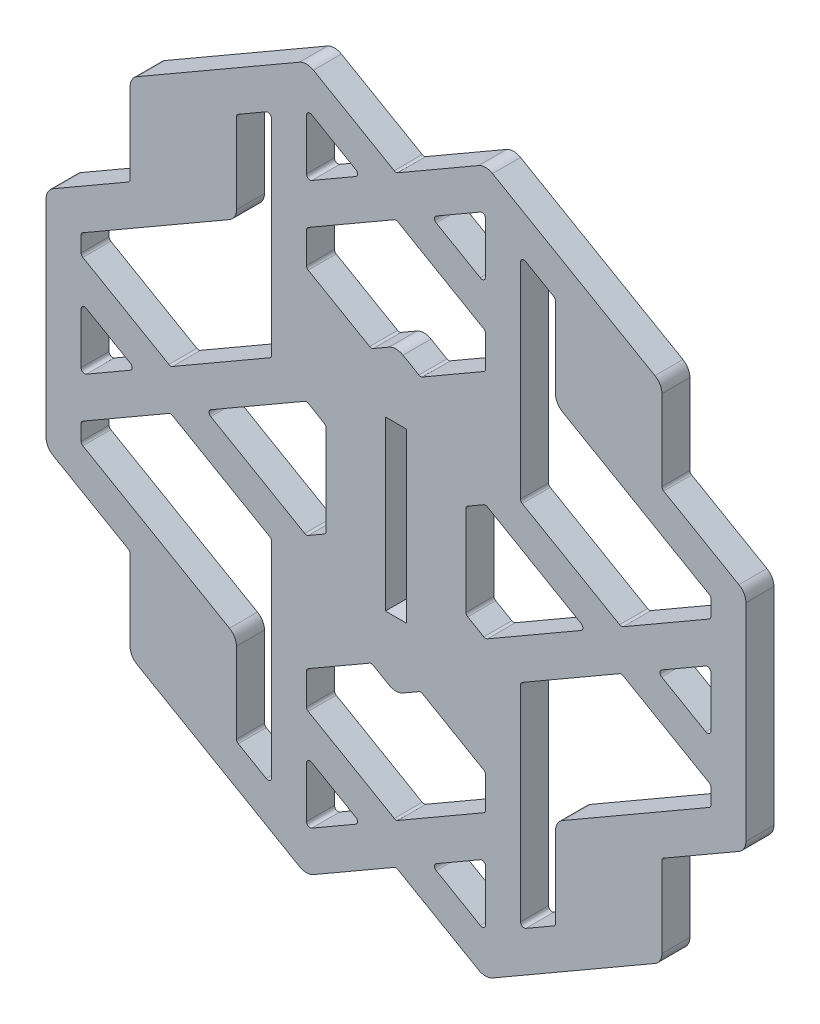
from build123d import *

# Parameters (mm, degrees)
EXTRUDE_1_DEPTH     = 4
SKETCH_2_W          = 3.02
SKETCH_2_H          = 24.02
CUT_EXTRUDE_1_DEPTH = 4
FILLET_1_R          = 2
FILLET_2_R          = 0.5


with BuildPart() as part:
    # 草图1 → 凸台-拉伸1 (new body)
    with BuildSketch(Plane.XY):
        Polygon((-38, -22.856406461), (-38, -35.79571669), (-12.794228634, -50.348275573), (0, -42.961524227), (12.794228634, -50.348275573), (38, -35.79571669), (38, -22.856406461), (50, -15.92820323), (50, -13.160254038), (50, 13.160254038), (50, 15.92820323), (38, 22.856406461), (38, 35.79571669), (12.794228634, 50.348275573), (0, 42.961524227), (-12.794228634, 50.348275573), (-38, 35.79571669), (-38, 22.856406461), (-50, 15.92820323), (-50, 13.160254038), (-50, -13.160254038), (-50, -15.92820323), align=None)
        Polygon((-10, -6.707259422), (-10, 6.707259422), (-12.794228634, 8.320508076), (-27.205771366, 0), (-12.794228634, -8.320508076), align=None, mode=Mode.SUBTRACT)
        Polygon((-12.794228634, -44.574772881), (-12.794228634, -35.574772881), (-5, -40.074772881), align=None, mode=Mode.SUBTRACT)
        Polygon((10, -6.707259422), (10, 6.707259422), (12.794228634, 8.320508076), (27.205771366, 0), (12.794228634, -8.320508076), align=None, mode=Mode.SUBTRACT)
        Polygon((-3.52146997, -19.447640478), (-12.794228634, -24.801270189), (-12.794228634, -29.801270189), (0, -37.188021535), (12.794228634, -29.801270189), (12.794228634, -24.801270189), (3.52146997, -19.447640478), (0, -21.480762114), align=None, mode=Mode.SUBTRACT)
        Polygon((12.794228634, -44.574772881), (12.794228634, -35.574772881), (5, -40.074772881), align=None, mode=Mode.SUBTRACT)
        Polygon((3.52146997, 19.447640478), (12.794228634, 24.801270189), (12.794228634, 29.801270189), (0, 37.188021535), (-12.794228634, 29.801270189), (-12.794228634, 24.801270189), (-3.52146997, 19.447640478), (0, 21.480762114), align=None, mode=Mode.SUBTRACT)
        Polygon((12.794228634, 44.574772881), (12.794228634, 35.574772881), (5, 40.074772881), align=None, mode=Mode.SUBTRACT)
        Polygon((-12.794228634, 44.574772881), (-12.794228634, 35.574772881), (-5, 40.074772881), align=None, mode=Mode.SUBTRACT)
        Polygon((-45, 4.5), (-45, -4.5), (-37.205771366, 0), align=None, mode=Mode.SUBTRACT)
        Polygon((45, -4.5), (37.205771366, 0), (45, 4.5), align=None, mode=Mode.SUBTRACT)
        Polygon((-32.205771366, 2.886751346), (-17.794228634, 11.207259422), (-17.794228634, 41.688021535), (-22.794228634, 38.801270189), (-22.794228634, 25.86195996), (-45, 13.041451884), (-45, 10.273502692), align=None, mode=Mode.SUBTRACT)
        Polygon((45, 13.041451884), (45, 10.273502692), (32.205771366, 2.886751346), (17.794228634, 11.207259422), (17.794228634, 41.688021535), (22.794228634, 38.801270189), (22.794228634, 25.86195996), align=None, mode=Mode.SUBTRACT)
        Polygon((22.794228634, -25.86195996), (45, -13.041451884), (45, -10.273502692), (32.205771366, -2.886751346), (17.794228634, -11.207259422), (17.794228634, -41.688021535), (22.794228634, -38.801270189), align=None, mode=Mode.SUBTRACT)
        Polygon((-45, -13.041451884), (-45, -10.273502692), (-32.205771366, -2.886751346), (-17.794228634, -11.207259422), (-17.794228634, -41.688021535), (-22.794228634, -38.801270189), (-22.794228634, -25.86195996), align=None, mode=Mode.SUBTRACT)
    extrude(amount=EXTRUDE_1_DEPTH)

    # 草图2 → 切除-拉伸1 (cut)
    with BuildSketch(Plane.XY):
        Rectangle(SKETCH_2_W, SKETCH_2_H)
    extrude(amount=CUT_EXTRUDE_1_DEPTH, mode=Mode.SUBTRACT)

    # 圆角1
    fillet_1_edges = [part.edges().sort_by_distance(p)[0] for p in [
        (38, -35.79571669, 2),
        (50, -15.92820323, 2),
        (50, 15.92820323, 2),
        (38, 35.79571669, 2),
        (12.794228634, 50.348275573, 2),
        (-12.794228634, 50.348275573, 2),
        (12.794228634, -50.348275573, 2),
        (-12.794228634, -50.348275573, 2),
        (-38, 35.79571669, 2),
        (-50, 15.92820323, 2),
        (-38, -35.79571669, 2),
        (-50, -15.92820323, 2),
        (-22.794228634, -25.86195996, 2),
        (22.794228634, -25.86195996, 2),
        (22.794228634, 25.86195996, 2),
        (-22.794228634, 25.86195996, 2),
        (0, -21.480762114, 2),
        (0, 21.480762114, 2),
    ]]
    fillet(fillet_1_edges, radius=FILLET_1_R)

    # 圆角2
    fillet_2_edges = [part.edges().sort_by_distance(p)[0] for p in [
        (3.52146997, 19.447640478, 2),
        (-3.52146997, 19.447640478, 2),
        (12.794228634, 29.801270189, 2),
        (12.794228634, 24.801270189, 2),
        (-12.794228634, 24.801270189, 2),
        (-12.794228634, 29.801270189, 2),
        (0, 37.188021535, 2),
        (-12.794228634, 35.574772881, 2),
        (-5, 40.074772881, 2),
        (-12.794228634, 44.574772881, 2),
        (45, -13.041451884, 2),
        (45, -10.273502692, 2),
        (32.205771366, -2.886751346, 2),
        (17.794228634, -11.207259422, 2),
        (22.794228634, -38.801270189, 2),
        (17.794228634, -41.688021535, 2),
        (12.794228634, -44.574772881, 2),
        (12.794228634, -35.574772881, 2),
        (5, -40.074772881, 2),
        (12.794228634, -29.801270189, 2),
        (12.794228634, -24.801270189, 2),
        (0, -37.188021535, 2),
        (3.52146997, -19.447640478, 2),
        (-3.52146997, -19.447640478, 2),
        (-12.794228634, -24.801270189, 2),
        (-12.794228634, -29.801270189, 2),
        (-5, -40.074772881, 2),
        (-12.794228634, -35.574772881, 2),
        (-12.794228634, -44.574772881, 2),
        (-22.794228634, -38.801270189, 2),
        (-17.794228634, -41.688021535, 2),
        (-17.794228634, -11.207259422, 2),
        (-32.205771366, -2.886751346, 2),
        (-45, -10.273502692, 2),
        (-45, -13.041451884, 2),
        (-10, 6.707259422, 2),
        (-12.794228634, 8.320508076, 2),
        (-27.205771366, 0, 2),
        (-12.794228634, -8.320508076, 2),
        (-10, -6.707259422, 2),
        (-45, 4.5, 2),
        (-45, -4.5, 2),
        (-37.205771366, 0, 2),
        (-22.794228634, 38.801270189, 2),
        (-45, 13.041451884, 2),
        (-45, 10.273502692, 2),
        (-32.205771366, 2.886751346, 2),
        (-17.794228634, 11.207259422, 2),
        (-17.794228634, 41.688021535, 2),
        (10, -6.707259422, 2),
        (12.794228634, -8.320508076, 2),
        (27.205771366, 0, 2),
        (10, 6.707259422, 2),
        (12.794228634, 8.320508076, 2),
        (37.205771366, 0, 2),
        (45, -4.5, 2),
        (45, 4.5, 2),
        (32.205771366, 2.886751346, 2),
        (17.794228634, 11.207259422, 2),
        (45, 10.273502692, 2),
        (45, 13.041451884, 2),
        (22.794228634, 38.801270189, 2),
        (17.794228634, 41.688021535, 2),
        (12.794228634, 35.574772881, 2),
        (12.794228634, 44.574772881, 2),
        (5, 40.074772881, 2),
        (-38, -22.856406461, 2),
        (0, -42.961524227, 2),
        (38, -22.856406461, 2),
        (38, 22.856406461, 2),
        (0, 42.961524227, 2),
        (-38, 22.856406461, 2),
    ]]
    fillet(fillet_2_edges, radius=FILLET_2_R)


solid = part.part
